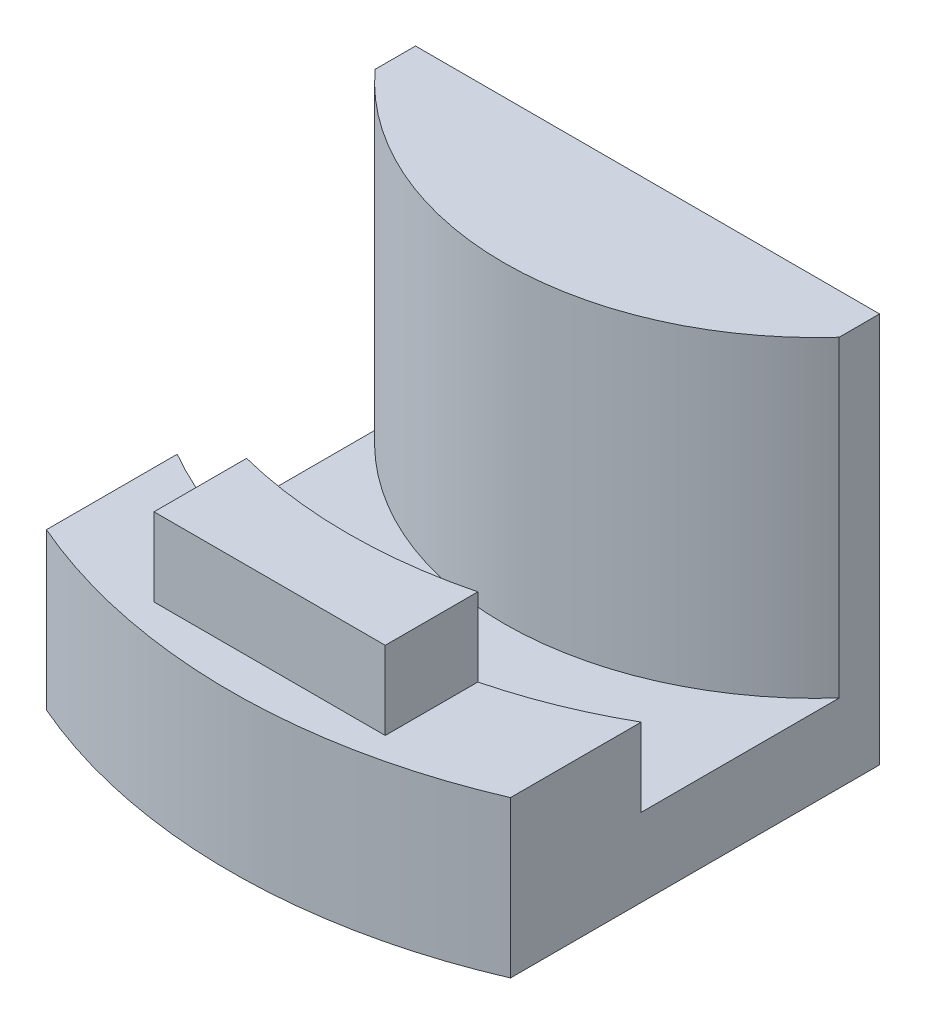
from build123d import *

# Parameters (mm, degrees)
SKETCH1_R           = 38.1
BOSS_EXTRUDE1_DEPTH = 6.35
SKETCH2_R           = 25.4
BOSS_EXTRUDE2_DEPTH = 25.4
SKETCH3_R           = 47.625
SKETCH3_R_2         = 38.1
BOSS_EXTRUDE3_DEPTH = 12.7
CUT_EXTRUDE3_DEPTH  = 75.460350187
BOSS_EXTRUDE4_DEPTH = 6.35


with BuildPart() as part:
    # Sketch1 → Boss-Extrude1 (new body)
    with BuildSketch(Plane(origin=(0, 0, 0), x_dir=(1, 0, 0), z_dir=(0, 1, 0))):
        Circle(SKETCH1_R)
    extrude(amount=BOSS_EXTRUDE1_DEPTH)

    # Sketch2 → Boss-Extrude2 (add)
    with BuildSketch(Plane(origin=(0, 6.35, 0), x_dir=(1, 0, 0), z_dir=(0, 1, 0))):
        Circle(SKETCH2_R)
    extrude(amount=BOSS_EXTRUDE2_DEPTH)

    # Sketch3 → Boss-Extrude3 (add)
    with BuildSketch(Plane(origin=(0, 0, 0), x_dir=(1, 0, 0), z_dir=(0, 1, 0))):
        Circle(SKETCH3_R)
        Circle(SKETCH3_R_2, mode=Mode.SUBTRACT)
    extrude(amount=BOSS_EXTRUDE3_DEPTH)

    # Sketch4 → Cut-Extrude3 (cut, through all)
    with BuildSketch(Plane(origin=(0, 0, 0), x_dir=(1, 0, 0), z_dir=(0, 1, 0))):
        Polygon((-18.8595, -13.731963353), (18.8595, -13.731963353), (18.8595, -50.573816251), (47.625, -50.573816251), (47.625, 47.625), (19.007906819, 47.625), (-18.8595, 47.625), (-47.625, 47.625), (-47.625, -44.321865457), (-18.8595, -44.321865457), align=None)
    extrude(amount=CUT_EXTRUDE3_DEPTH, mode=Mode.SUBTRACT)

    # Sketch5 → Boss-Extrude4 (add)
    with BuildSketch(Plane(origin=(0, 12.7, 0), x_dir=(1, 0, 0), z_dir=(0, 1, 0))):
        with BuildLine():
            Line((-9.398, -44.45), (9.398, -44.45))
            Line((9.398, -44.45), (9.398, -36.922724656))
            ThreePointArc((9.398, -36.922724656), (0, -38.1), (-9.398, -36.922724656))
            Line((-9.398, -36.922724656), (-9.398, -44.45))
        make_face()
    extrude(amount=BOSS_EXTRUDE4_DEPTH)


solid = part.part
